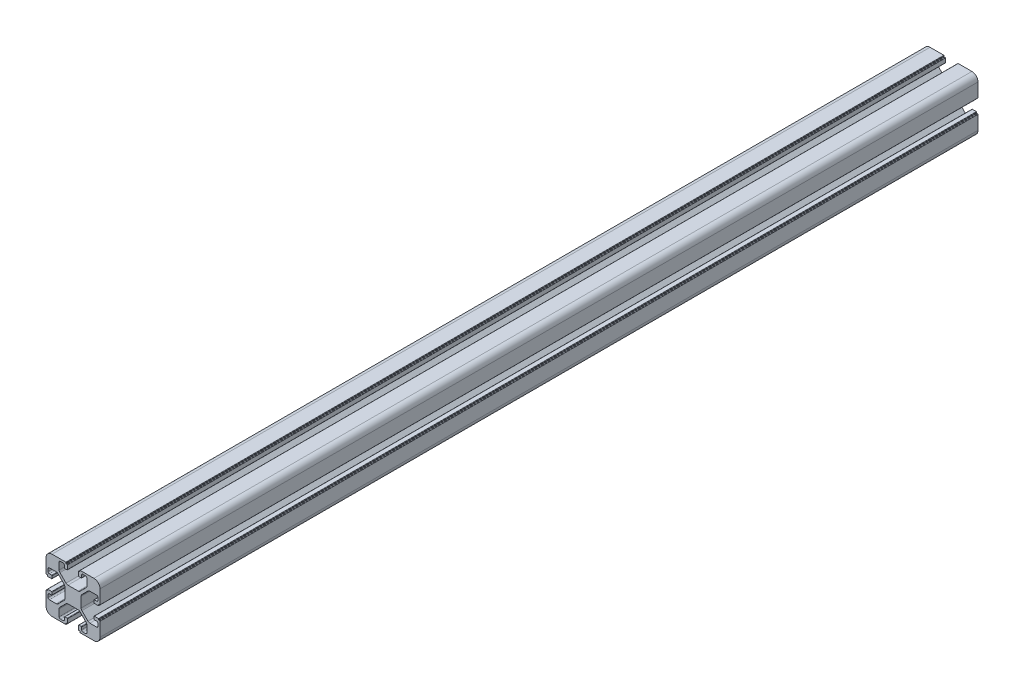
from build123d import *

# Parameters (mm, degrees)
SKETCH2_R           = 3.4
BOSS_EXTRUDE1_DEPTH = 50
BOSS_EXTRUDE2_DEPTH = 600


with BuildPart() as part:
    # Sketch2 → Boss-Extrude1 (new body)
    with BuildSketch(Plane.XY):
        with BuildLine():
            Line((4.5, 0), (14.7, 0))
            ThreePointArc((14.7, 0), (14.841421356, 0.058578644), (14.9, 0.2))
            Line((14.9, 0.2), (14.9, 0.8))
            ThreePointArc((14.9, 0.8), (14.958578644, 0.941421356), (15.1, 1))
            Line((15.1, 1), (15.7, 1))
            ThreePointArc((15.7, 1), (15.841421356, 1.058578644), (15.9, 1.2))
            Line((15.9, 1.2), (15.9, 4.2))
            ThreePointArc((15.9, 4.2), (15.812132034, 4.412132034), (15.6, 4.5))
            Line((15.6, 4.5), (13.9, 4.5))
            ThreePointArc((13.9, 4.5), (13.687867966, 4.412132034), (13.6, 4.2))
            Line((13.6, 4.2), (13.6, 2.5))
            ThreePointArc((13.6, 2.5), (13.307106781, 1.792893219), (12.6, 1.5))
            Line((12.6, 1.5), (10.75, 1.5))
            ThreePointArc((10.75, 1.5), (10.042893219, 1.792893219), (9.75, 2.5))
            Line((9.75, 2.5), (9.75, 7.507359313))
            ThreePointArc((9.75, 7.507359313), (9.902240935, 8.272726178), (10.335786438, 8.921572875))
            Line((10.335786438, 8.921572875), (14.828427125, 13.414213562))
            ThreePointArc((14.828427125, 13.414213562), (15.477273822, 13.847759065), (16.242640687, 14))
            Line((16.242640687, 14), (23.757359313, 14))
            ThreePointArc((23.757359313, 14), (24.522726178, 13.847759065), (25.171572875, 13.414213562))
            Line((25.171572875, 13.414213562), (29.664213562, 8.921572875))
            ThreePointArc((29.664213562, 8.921572875), (30.097759065, 8.272726178), (30.25, 7.507359313))
            Line((30.25, 7.507359313), (30.25, 2.5))
            ThreePointArc((30.25, 2.5), (29.957106781, 1.792893219), (29.25, 1.5))
            Line((29.25, 1.5), (27.4, 1.5))
            ThreePointArc((27.4, 1.5), (26.692893219, 1.792893219), (26.4, 2.5))
            Line((26.4, 2.5), (26.4, 4.2))
            ThreePointArc((26.4, 4.2), (26.312132034, 4.412132034), (26.1, 4.5))
            Line((26.1, 4.5), (24.4, 4.5))
            ThreePointArc((24.4, 4.5), (24.187867966, 4.412132034), (24.1, 4.2))
            Line((24.1, 4.2), (24.1, 1.2))
            ThreePointArc((24.1, 1.2), (24.158578644, 1.058578644), (24.3, 1))
            Line((24.3, 1), (24.9, 1))
            ThreePointArc((24.9, 1), (25.041421356, 0.941421356), (25.1, 0.8))
            Line((25.1, 0.8), (25.1, 0.2))
            ThreePointArc((25.1, 0.2), (25.158578644, 0.058578644), (25.3, 0))
            Line((25.3, 0), (35.5, 0))
            ThreePointArc((35.5, 0), (38.681980515, 1.318019485), (40, 4.5))
            Line((40, 4.5), (40, 14.7))
            ThreePointArc((40, 14.7), (39.941421356, 14.841421356), (39.8, 14.9))
            Line((39.8, 14.9), (39.2, 14.9))
            ThreePointArc((39.2, 14.9), (39.058578644, 14.958578644), (39, 15.1))
            Line((39, 15.1), (39, 15.7))
            ThreePointArc((39, 15.7), (38.941421356, 15.841421356), (38.8, 15.9))
            Line((38.8, 15.9), (35.8, 15.9))
            ThreePointArc((35.8, 15.9), (35.587867966, 15.812132034), (35.5, 15.6))
            Line((35.5, 15.6), (35.5, 13.9))
            ThreePointArc((35.5, 13.9), (35.587867966, 13.687867966), (35.8, 13.6))
            Line((35.8, 13.6), (37.5, 13.6))
            ThreePointArc((37.5, 13.6), (38.207106781, 13.307106781), (38.5, 12.6))
            Line((38.5, 12.6), (38.5, 10.75))
            ThreePointArc((38.5, 10.75), (38.207106781, 10.042893219), (37.5, 9.75))
            Line((37.5, 9.75), (32.492640687, 9.75))
            ThreePointArc((32.492640687, 9.75), (31.727273822, 9.902240935), (31.078427125, 10.335786438))
            Line((31.078427125, 10.335786438), (26.585786438, 14.828427125))
            ThreePointArc((26.585786438, 14.828427125), (26.152240935, 15.477273822), (26, 16.242640687))
            Line((26, 16.242640687), (26, 23.757359313))
            ThreePointArc((26, 23.757359313), (26.152240935, 24.522726178), (26.585786438, 25.171572875))
            Line((26.585786438, 25.171572875), (31.078427125, 29.664213562))
            ThreePointArc((31.078427125, 29.664213562), (31.727273822, 30.097759065), (32.492640687, 30.25))
            Line((32.492640687, 30.25), (37.5, 30.25))
            ThreePointArc((37.5, 30.25), (38.207106781, 29.957106781), (38.5, 29.25))
            Line((38.5, 29.25), (38.5, 27.4))
            ThreePointArc((38.5, 27.4), (38.207106781, 26.692893219), (37.5, 26.4))
            Line((37.5, 26.4), (35.8, 26.4))
            ThreePointArc((35.8, 26.4), (35.587867966, 26.312132034), (35.5, 26.1))
            Line((35.5, 26.1), (35.5, 24.4))
            ThreePointArc((35.5, 24.4), (35.587867966, 24.187867966), (35.8, 24.1))
            Line((35.8, 24.1), (38.8, 24.1))
            ThreePointArc((38.8, 24.1), (38.941421356, 24.158578644), (39, 24.3))
            Line((39, 24.3), (39, 24.9))
            ThreePointArc((39, 24.9), (39.058578644, 25.041421356), (39.2, 25.1))
            Line((39.2, 25.1), (39.8, 25.1))
            ThreePointArc((39.8, 25.1), (39.941421356, 25.158578644), (40, 25.3))
            Line((40, 25.3), (40, 35.5))
            ThreePointArc((40, 35.5), (38.681980515, 38.681980515), (35.5, 40))
            Line((35.5, 40), (25.3, 40))
            ThreePointArc((25.3, 40), (25.158578644, 39.941421356), (25.1, 39.8))
            Line((25.1, 39.8), (25.1, 39.2))
            ThreePointArc((25.1, 39.2), (25.041421356, 39.058578644), (24.9, 39))
            Line((24.9, 39), (24.3, 39))
            ThreePointArc((24.3, 39), (24.158578644, 38.941421356), (24.1, 38.8))
            Line((24.1, 38.8), (24.1, 35.8))
            ThreePointArc((24.1, 35.8), (24.187867966, 35.587867966), (24.4, 35.5))
            Line((24.4, 35.5), (26.1, 35.5))
            ThreePointArc((26.1, 35.5), (26.312132034, 35.587867966), (26.4, 35.8))
            Line((26.4, 35.8), (26.4, 37.5))
            ThreePointArc((26.4, 37.5), (26.692893219, 38.207106781), (27.4, 38.5))
            Line((27.4, 38.5), (29.25, 38.5))
            ThreePointArc((29.25, 38.5), (29.957106781, 38.207106781), (30.25, 37.5))
            Line((30.25, 37.5), (30.25, 32.492640687))
            ThreePointArc((30.25, 32.492640687), (30.097759065, 31.727273822), (29.664213562, 31.078427125))
            Line((29.664213562, 31.078427125), (25.171572875, 26.585786438))
            ThreePointArc((25.171572875, 26.585786438), (24.522726178, 26.152240935), (23.757359313, 26))
            Line((23.757359313, 26), (16.242640687, 26))
            ThreePointArc((16.242640687, 26), (15.477273822, 26.152240935), (14.828427125, 26.585786438))
            Line((14.828427125, 26.585786438), (10.335786438, 31.078427125))
            ThreePointArc((10.335786438, 31.078427125), (9.902240935, 31.727273822), (9.75, 32.492640687))
            Line((9.75, 32.492640687), (9.75, 37.5))
            ThreePointArc((9.75, 37.5), (10.042893219, 38.207106781), (10.75, 38.5))
            Line((10.75, 38.5), (12.6, 38.5))
            ThreePointArc((12.6, 38.5), (13.307106781, 38.207106781), (13.6, 37.5))
            Line((13.6, 37.5), (13.6, 35.8))
            ThreePointArc((13.6, 35.8), (13.687867966, 35.587867966), (13.9, 35.5))
            Line((13.9, 35.5), (15.6, 35.5))
            ThreePointArc((15.6, 35.5), (15.812132034, 35.587867966), (15.9, 35.8))
            Line((15.9, 35.8), (15.9, 38.8))
            ThreePointArc((15.9, 38.8), (15.841421356, 38.941421356), (15.7, 39))
            Line((15.7, 39), (15.1, 39))
            ThreePointArc((15.1, 39), (14.958578644, 39.058578644), (14.9, 39.2))
            Line((14.9, 39.2), (14.9, 39.8))
            ThreePointArc((14.9, 39.8), (14.841421356, 39.941421356), (14.7, 40))
            Line((14.7, 40), (4.5, 40))
            ThreePointArc((4.5, 40), (1.318019485, 38.681980515), (0, 35.5))
            Line((0, 35.5), (0, 25.3))
            ThreePointArc((0, 25.3), (0.058578644, 25.158578644), (0.2, 25.1))
            Line((0.2, 25.1), (0.8, 25.1))
            ThreePointArc((0.8, 25.1), (0.941421356, 25.041421356), (1, 24.9))
            Line((1, 24.9), (1, 24.3))
            ThreePointArc((1, 24.3), (1.058578644, 24.158578644), (1.2, 24.1))
            Line((1.2, 24.1), (4.2, 24.1))
            ThreePointArc((4.2, 24.1), (4.412132034, 24.187867966), (4.5, 24.4))
            Line((4.5, 24.4), (4.5, 26.1))
            ThreePointArc((4.5, 26.1), (4.412132034, 26.312132034), (4.2, 26.4))
            Line((4.2, 26.4), (2.5, 26.4))
            ThreePointArc((2.5, 26.4), (1.792893219, 26.692893219), (1.5, 27.4))
            Line((1.5, 27.4), (1.5, 29.25))
            ThreePointArc((1.5, 29.25), (1.792893219, 29.957106781), (2.5, 30.25))
            Line((2.5, 30.25), (7.507359313, 30.25))
            ThreePointArc((7.507359313, 30.25), (8.272726178, 30.097759065), (8.921572875, 29.664213562))
            Line((8.921572875, 29.664213562), (13.414213562, 25.171572875))
            ThreePointArc((13.414213562, 25.171572875), (13.847759065, 24.522726178), (14, 23.757359313))
            Line((14, 23.757359313), (14, 16.242640687))
            ThreePointArc((14, 16.242640687), (13.847759065, 15.477273822), (13.414213562, 14.828427125))
            Line((13.414213562, 14.828427125), (8.921572875, 10.335786438))
            ThreePointArc((8.921572875, 10.335786438), (8.272726178, 9.902240935), (7.507359313, 9.75))
            Line((7.507359313, 9.75), (2.5, 9.75))
            ThreePointArc((2.5, 9.75), (1.792893219, 10.042893219), (1.5, 10.75))
            Line((1.5, 10.75), (1.5, 12.6))
            ThreePointArc((1.5, 12.6), (1.792893219, 13.307106781), (2.5, 13.6))
            Line((2.5, 13.6), (4.2, 13.6))
            ThreePointArc((4.2, 13.6), (4.412132034, 13.687867966), (4.5, 13.9))
            Line((4.5, 13.9), (4.5, 15.6))
            ThreePointArc((4.5, 15.6), (4.412132034, 15.812132034), (4.2, 15.9))
            Line((4.2, 15.9), (1.2, 15.9))
            ThreePointArc((1.2, 15.9), (1.058578644, 15.841421356), (1, 15.7))
            Line((1, 15.7), (1, 15.1))
            ThreePointArc((1, 15.1), (0.941421356, 14.958578644), (0.8, 14.9))
            Line((0.8, 14.9), (0.2, 14.9))
            ThreePointArc((0.2, 14.9), (0.058578644, 14.841421356), (0, 14.7))
            Line((0, 14.7), (0, 4.5))
            ThreePointArc((0, 4.5), (1.318019485, 1.318019485), (4.5, 0))
        make_face()
        with Locations((20, 20)):
            Circle(SKETCH2_R, mode=Mode.SUBTRACT)
        with BuildLine():
            Line((31.55, 37.7), (31.55, 32.55))
            ThreePointArc((31.55, 32.55), (31.842893219, 31.842893219), (32.55, 31.55))
            Line((32.55, 31.55), (37.7, 31.55))
            ThreePointArc((37.7, 31.55), (38.407106781, 31.842893219), (38.7, 32.55))
            Line((38.7, 32.55), (38.7, 35.5))
            ThreePointArc((38.7, 35.5), (37.7627417, 37.7627417), (35.5, 38.7))
            Line((35.5, 38.7), (32.55, 38.7))
            ThreePointArc((32.55, 38.7), (31.842893219, 38.407106781), (31.55, 37.7))
        make_face(mode=Mode.SUBTRACT)
        with BuildLine():
            Line((1.3, 35.5), (1.3, 32.55))
            ThreePointArc((1.3, 32.55), (1.592893219, 31.842893219), (2.3, 31.55))
            Line((2.3, 31.55), (7.45, 31.55))
            ThreePointArc((7.45, 31.55), (8.157106781, 31.842893219), (8.45, 32.55))
            Line((8.45, 32.55), (8.45, 37.7))
            ThreePointArc((8.45, 37.7), (8.157106781, 38.407106781), (7.45, 38.7))
            Line((7.45, 38.7), (4.5, 38.7))
            ThreePointArc((4.5, 38.7), (2.2372583, 37.7627417), (1.3, 35.5))
        make_face(mode=Mode.SUBTRACT)
        with BuildLine():
            Line((1.3, 7.45), (1.3, 4.5))
            ThreePointArc((1.3, 4.5), (2.2372583, 2.2372583), (4.5, 1.3))
            Line((4.5, 1.3), (7.45, 1.3))
            ThreePointArc((7.45, 1.3), (8.157106781, 1.592893219), (8.45, 2.3))
            Line((8.45, 2.3), (8.45, 7.45))
            ThreePointArc((8.45, 7.45), (8.157106781, 8.157106781), (7.45, 8.45))
            Line((7.45, 8.45), (2.3, 8.45))
            ThreePointArc((2.3, 8.45), (1.592893219, 8.157106781), (1.3, 7.45))
        make_face(mode=Mode.SUBTRACT)
        with BuildLine():
            Line((31.55, 7.45), (31.55, 2.3))
            ThreePointArc((31.55, 2.3), (31.842893219, 1.592893219), (32.55, 1.3))
            Line((32.55, 1.3), (35.5, 1.3))
            ThreePointArc((35.5, 1.3), (37.7627417, 2.2372583), (38.7, 4.5))
            Line((38.7, 4.5), (38.7, 7.45))
            ThreePointArc((38.7, 7.45), (38.407106781, 8.157106781), (37.7, 8.45))
            Line((37.7, 8.45), (32.55, 8.45))
            ThreePointArc((32.55, 8.45), (31.842893219, 8.157106781), (31.55, 7.45))
        make_face(mode=Mode.SUBTRACT)
    extrude(amount=BOSS_EXTRUDE1_DEPTH)

    # Sketch3 → Boss-Extrude2 (add)
    with BuildSketch(Plane.XY.offset(50)):
        with BuildLine():
            Line((25.3, 0), (35.5, 0))
            ThreePointArc((35.5, 0), (38.681980515, 1.318019485), (40, 4.5))
            Line((40, 4.5), (40, 14.7))
            ThreePointArc((40, 14.7), (39.941421356, 14.841421356), (39.8, 14.9))
            Line((39.8, 14.9), (39.2, 14.9))
            ThreePointArc((39.2, 14.9), (39.058578644, 14.958578644), (39, 15.1))
            Line((39, 15.1), (39, 15.7))
            ThreePointArc((39, 15.7), (38.941421356, 15.841421356), (38.8, 15.9))
            Line((38.8, 15.9), (35.8, 15.9))
            ThreePointArc((35.8, 15.9), (35.587867966, 15.812132034), (35.5, 15.6))
            Line((35.5, 15.6), (35.5, 13.9))
            ThreePointArc((35.5, 13.9), (35.587867966, 13.687867966), (35.8, 13.6))
            Line((35.8, 13.6), (37.5, 13.6))
            ThreePointArc((37.5, 13.6), (38.207106781, 13.307106781), (38.5, 12.6))
            Line((38.5, 12.6), (38.5, 10.75))
            ThreePointArc((38.5, 10.75), (38.207106781, 10.042893219), (37.5, 9.75))
            Line((37.5, 9.75), (32.492640687, 9.75))
            ThreePointArc((32.492640687, 9.75), (31.727273822, 9.902240935), (31.078427125, 10.335786438))
            Line((31.078427125, 10.335786438), (26.585786438, 14.828427125))
            ThreePointArc((26.585786438, 14.828427125), (26.152240935, 15.477273822), (26, 16.242640687))
            Line((26, 16.242640687), (26, 23.757359313))
            ThreePointArc((26, 23.757359313), (26.152240935, 24.522726178), (26.585786438, 25.171572875))
            Line((26.585786438, 25.171572875), (31.078427125, 29.664213562))
            ThreePointArc((31.078427125, 29.664213562), (31.727273822, 30.097759065), (32.492640687, 30.25))
            Line((32.492640687, 30.25), (37.5, 30.25))
            ThreePointArc((37.5, 30.25), (38.207106781, 29.957106781), (38.5, 29.25))
            Line((38.5, 29.25), (38.5, 27.4))
            ThreePointArc((38.5, 27.4), (38.207106781, 26.692893219), (37.5, 26.4))
            Line((37.5, 26.4), (35.8, 26.4))
            ThreePointArc((35.8, 26.4), (35.587867966, 26.312132034), (35.5, 26.1))
            Line((35.5, 26.1), (35.5, 24.4))
            ThreePointArc((35.5, 24.4), (35.587867966, 24.187867966), (35.8, 24.1))
            Line((35.8, 24.1), (38.8, 24.1))
            ThreePointArc((38.8, 24.1), (38.941421356, 24.158578644), (39, 24.3))
            Line((39, 24.3), (39, 24.9))
            ThreePointArc((39, 24.9), (39.058578644, 25.041421356), (39.2, 25.1))
            Line((39.2, 25.1), (39.8, 25.1))
            ThreePointArc((39.8, 25.1), (39.941421356, 25.158578644), (40, 25.3))
            Line((40, 25.3), (40, 35.5))
            ThreePointArc((40, 35.5), (38.681980515, 38.681980515), (35.5, 40))
            Line((35.5, 40), (25.3, 40))
            ThreePointArc((25.3, 40), (25.158578644, 39.941421356), (25.1, 39.8))
            Line((25.1, 39.8), (25.1, 39.2))
            ThreePointArc((25.1, 39.2), (25.041421356, 39.058578644), (24.9, 39))
            Line((24.9, 39), (24.3, 39))
            ThreePointArc((24.3, 39), (24.158578644, 38.941421356), (24.1, 38.8))
            Line((24.1, 38.8), (24.1, 35.8))
            ThreePointArc((24.1, 35.8), (24.187867966, 35.587867966), (24.4, 35.5))
            Line((24.4, 35.5), (26.1, 35.5))
            ThreePointArc((26.1, 35.5), (26.312132034, 35.587867966), (26.4, 35.8))
            Line((26.4, 35.8), (26.4, 37.5))
            ThreePointArc((26.4, 37.5), (26.692893219, 38.207106781), (27.4, 38.5))
            Line((27.4, 38.5), (29.25, 38.5))
            ThreePointArc((29.25, 38.5), (29.957106781, 38.207106781), (30.25, 37.5))
            Line((30.25, 37.5), (30.25, 32.492640687))
            ThreePointArc((30.25, 32.492640687), (30.097759065, 31.727273822), (29.664213562, 31.078427125))
            Line((29.664213562, 31.078427125), (25.171572875, 26.585786438))
            ThreePointArc((25.171572875, 26.585786438), (24.522726178, 26.152240935), (23.757359313, 26))
            Line((23.757359313, 26), (16.242640687, 26))
            ThreePointArc((16.242640687, 26), (15.477273822, 26.152240935), (14.828427125, 26.585786438))
            Line((14.828427125, 26.585786438), (10.335786438, 31.078427125))
            ThreePointArc((10.335786438, 31.078427125), (9.902240935, 31.727273822), (9.75, 32.492640687))
            Line((9.75, 32.492640687), (9.75, 37.5))
            ThreePointArc((9.75, 37.5), (10.042893219, 38.207106781), (10.75, 38.5))
            Line((10.75, 38.5), (12.6, 38.5))
            ThreePointArc((12.6, 38.5), (13.307106781, 38.207106781), (13.6, 37.5))
            Line((13.6, 37.5), (13.6, 35.8))
            ThreePointArc((13.6, 35.8), (13.687867966, 35.587867966), (13.9, 35.5))
            Line((13.9, 35.5), (15.6, 35.5))
            ThreePointArc((15.6, 35.5), (15.812132034, 35.587867966), (15.9, 35.8))
            Line((15.9, 35.8), (15.9, 38.8))
            ThreePointArc((15.9, 38.8), (15.841421356, 38.941421356), (15.7, 39))
            Line((15.7, 39), (15.1, 39))
            ThreePointArc((15.1, 39), (14.958578644, 39.058578644), (14.9, 39.2))
            Line((14.9, 39.2), (14.9, 39.8))
            ThreePointArc((14.9, 39.8), (14.841421356, 39.941421356), (14.7, 40))
            Line((14.7, 40), (4.5, 40))
            ThreePointArc((4.5, 40), (1.318019485, 38.681980515), (0, 35.5))
            Line((0, 35.5), (0, 25.3))
            ThreePointArc((0, 25.3), (0.058578644, 25.158578644), (0.2, 25.1))
            Line((0.2, 25.1), (0.8, 25.1))
            ThreePointArc((0.8, 25.1), (0.941421356, 25.041421356), (1, 24.9))
            Line((1, 24.9), (1, 24.3))
            ThreePointArc((1, 24.3), (1.058578644, 24.158578644), (1.2, 24.1))
            Line((1.2, 24.1), (4.2, 24.1))
            ThreePointArc((4.2, 24.1), (4.412132034, 24.187867966), (4.5, 24.4))
            Line((4.5, 24.4), (4.5, 26.1))
            ThreePointArc((4.5, 26.1), (4.412132034, 26.312132034), (4.2, 26.4))
            Line((4.2, 26.4), (2.5, 26.4))
            ThreePointArc((2.5, 26.4), (1.792893219, 26.692893219), (1.5, 27.4))
            Line((1.5, 27.4), (1.5, 29.25))
            ThreePointArc((1.5, 29.25), (1.792893219, 29.957106781), (2.5, 30.25))
            Line((2.5, 30.25), (7.507359313, 30.25))
            ThreePointArc((7.507359313, 30.25), (8.272726178, 30.097759065), (8.921572875, 29.664213562))
            Line((8.921572875, 29.664213562), (13.414213562, 25.171572875))
            ThreePointArc((13.414213562, 25.171572875), (13.847759065, 24.522726178), (14, 23.757359313))
            Line((14, 23.757359313), (14, 16.242640687))
            ThreePointArc((14, 16.242640687), (13.847759065, 15.477273822), (13.414213562, 14.828427125))
            Line((13.414213562, 14.828427125), (8.921572875, 10.335786438))
            ThreePointArc((8.921572875, 10.335786438), (8.272726178, 9.902240935), (7.507359313, 9.75))
            Line((7.507359313, 9.75), (2.5, 9.75))
            ThreePointArc((2.5, 9.75), (1.792893219, 10.042893219), (1.5, 10.75))
            Line((1.5, 10.75), (1.5, 12.6))
            ThreePointArc((1.5, 12.6), (1.792893219, 13.307106781), (2.5, 13.6))
            Line((2.5, 13.6), (4.2, 13.6))
            ThreePointArc((4.2, 13.6), (4.412132034, 13.687867966), (4.5, 13.9))
            Line((4.5, 13.9), (4.5, 15.6))
            ThreePointArc((4.5, 15.6), (4.412132034, 15.812132034), (4.2, 15.9))
            Line((4.2, 15.9), (1.2, 15.9))
            ThreePointArc((1.2, 15.9), (1.058578644, 15.841421356), (1, 15.7))
            Line((1, 15.7), (1, 15.1))
            ThreePointArc((1, 15.1), (0.941421356, 14.958578644), (0.8, 14.9))
            Line((0.8, 14.9), (0.2, 14.9))
            ThreePointArc((0.2, 14.9), (0.058578644, 14.841421356), (0, 14.7))
            Line((0, 14.7), (0, 4.5))
            ThreePointArc((0, 4.5), (1.318019485, 1.318019485), (4.5, 0))
            Line((4.5, 0), (14.7, 0))
            ThreePointArc((14.7, 0), (14.841421356, 0.058578644), (14.9, 0.2))
            Line((14.9, 0.2), (14.9, 0.8))
            ThreePointArc((14.9, 0.8), (14.958578644, 0.941421356), (15.1, 1))
            Line((15.1, 1), (15.7, 1))
            ThreePointArc((15.7, 1), (15.841421356, 1.058578644), (15.9, 1.2))
            Line((15.9, 1.2), (15.9, 4.2))
            ThreePointArc((15.9, 4.2), (15.812132034, 4.412132034), (15.6, 4.5))
            Line((15.6, 4.5), (13.9, 4.5))
            ThreePointArc((13.9, 4.5), (13.687867966, 4.412132034), (13.6, 4.2))
            Line((13.6, 4.2), (13.6, 2.5))
            ThreePointArc((13.6, 2.5), (13.307106781, 1.792893219), (12.6, 1.5))
            Line((12.6, 1.5), (10.75, 1.5))
            ThreePointArc((10.75, 1.5), (10.042893219, 1.792893219), (9.75, 2.5))
            Line((9.75, 2.5), (9.75, 7.507359313))
            ThreePointArc((9.75, 7.507359313), (9.902240935, 8.272726178), (10.335786438, 8.921572875))
            Line((10.335786438, 8.921572875), (14.828427125, 13.414213562))
            ThreePointArc((14.828427125, 13.414213562), (15.477273822, 13.847759065), (16.242640687, 14))
            Line((16.242640687, 14), (23.757359313, 14))
            ThreePointArc((23.757359313, 14), (24.522726178, 13.847759065), (25.171572875, 13.414213562))
            Line((25.171572875, 13.414213562), (29.664213562, 8.921572875))
            ThreePointArc((29.664213562, 8.921572875), (30.097759065, 8.272726178), (30.25, 7.507359313))
            Line((30.25, 7.507359313), (30.25, 2.5))
            ThreePointArc((30.25, 2.5), (29.957106781, 1.792893219), (29.25, 1.5))
            Line((29.25, 1.5), (27.4, 1.5))
            ThreePointArc((27.4, 1.5), (26.692893219, 1.792893219), (26.4, 2.5))
            Line((26.4, 2.5), (26.4, 4.2))
            ThreePointArc((26.4, 4.2), (26.312132034, 4.412132034), (26.1, 4.5))
            Line((26.1, 4.5), (24.4, 4.5))
            ThreePointArc((24.4, 4.5), (24.187867966, 4.412132034), (24.1, 4.2))
            Line((24.1, 4.2), (24.1, 1.2))
            ThreePointArc((24.1, 1.2), (24.158578644, 1.058578644), (24.3, 1))
            Line((24.3, 1), (24.9, 1))
            ThreePointArc((24.9, 1), (25.041421356, 0.941421356), (25.1, 0.8))
            Line((25.1, 0.8), (25.1, 0.2))
            ThreePointArc((25.1, 0.2), (25.158578644, 0.058578644), (25.3, 0))
        make_face()
    extrude(amount=BOSS_EXTRUDE2_DEPTH)


solid = part.part
